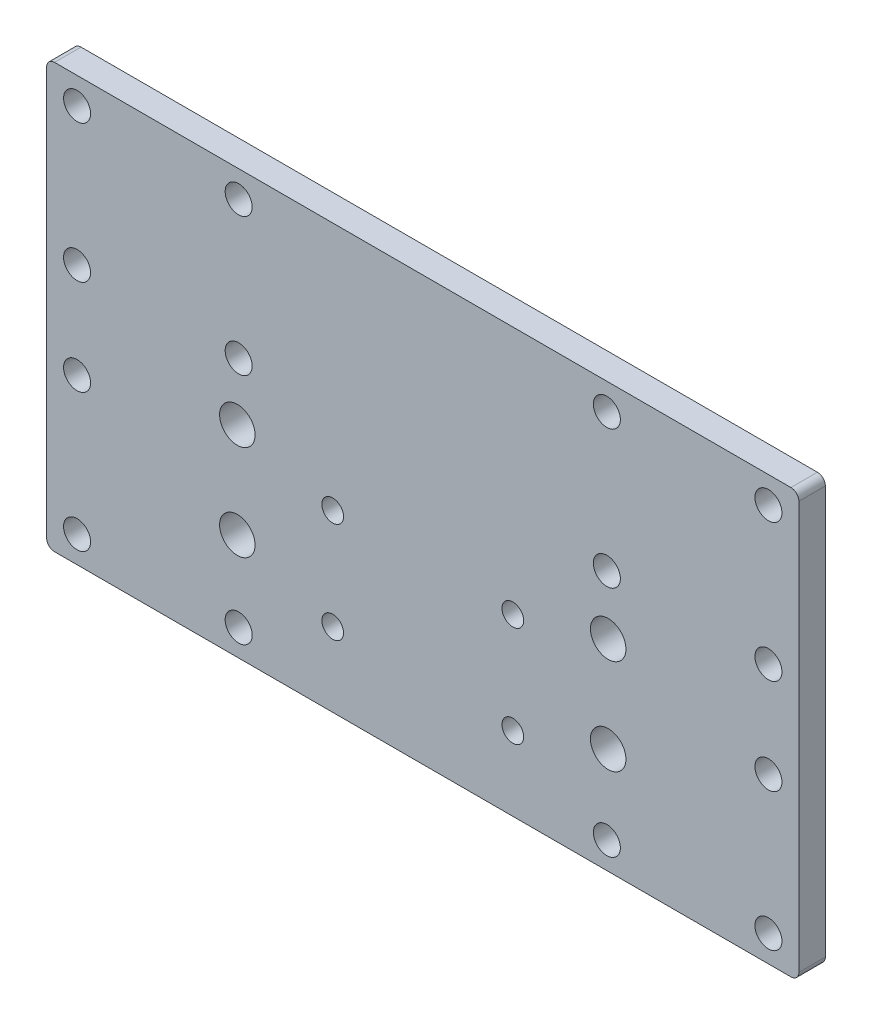
from build123d import *

# Parameters (mm, degrees)
SKETCH1_W           = 142
SKETCH1_H           = 80
BOSS_EXTRUDE1_DEPTH = 2.5
SKETCH2_R           = 2.55
CUT_EXTRUDE1_DEPTH  = 82.645575508
SKETCH3_R           = 2.05
CUT_EXTRUDE2_DEPTH  = 82.645575508
SKETCH4_R           = 3.35
CUT_EXTRUDE3_DEPTH  = 82.645575508
FILLET1_R           = 1.5


with BuildPart() as part:
    # Sketch1 → Boss-Extrude1 (new, symmetric)
    with BuildSketch(Plane.XY):
        Rectangle(SKETCH1_W, SKETCH1_H)
    extrude(amount=BOSS_EXTRUDE1_DEPTH, both=True)

    # Sketch2 → Cut-Extrude1 (cut, through all)
    with BuildSketch(Plane.XY.offset(2.5)):
        with Locations((-65.25, 35)):
            Circle(SKETCH2_R)
        with Locations((-34.75, 35)):
            Circle(SKETCH2_R)
        with Locations((-34.75, 9)):
            Circle(SKETCH2_R)
        with Locations((-65.25, 9)):
            Circle(SKETCH2_R)
        with Locations((65.25, 35)):
            Circle(SKETCH2_R)
        with Locations((65.25, 9)):
            Circle(SKETCH2_R)
        with Locations((34.75, 9)):
            Circle(SKETCH2_R)
        with Locations((34.75, 35)):
            Circle(SKETCH2_R)
        with Locations((-65.25, -9)):
            Circle(SKETCH2_R)
        with Locations((-34.75, -35)):
            Circle(SKETCH2_R)
        with Locations((-65.25, -35)):
            Circle(SKETCH2_R)
        with Locations((65.25, -9)):
            Circle(SKETCH2_R)
        with Locations((65.25, -35)):
            Circle(SKETCH2_R)
        with Locations((34.75, -35)):
            Circle(SKETCH2_R)
    extrude(amount=-CUT_EXTRUDE1_DEPTH, mode=Mode.SUBTRACT)

    # Sketch3 → Cut-Extrude2 (cut, through all)
    with BuildSketch(Plane.XY.offset(2.5)):
        with Locations((-17, -7)):
            Circle(SKETCH3_R)
        with Locations((-17, -26)):
            Circle(SKETCH3_R)
        with Locations((17, -26)):
            Circle(SKETCH3_R)
        with Locations((17, -7)):
            Circle(SKETCH3_R)
    extrude(amount=-CUT_EXTRUDE2_DEPTH, mode=Mode.SUBTRACT)

    # Sketch4 → Cut-Extrude3 (cut, through all)
    with BuildSketch(Plane.XY.offset(2.5)):
        with Locations((-35, -2)):
            Circle(SKETCH4_R)
        with Locations((35, -2)):
            Circle(SKETCH4_R)
        with Locations((35, -20)):
            Circle(SKETCH4_R)
        with Locations((-35, -20)):
            Circle(SKETCH4_R)
    extrude(amount=-CUT_EXTRUDE3_DEPTH, mode=Mode.SUBTRACT)

    # Fillet1
    fillet1_edges = [part.edges().sort_by_distance(p)[0] for p in [
        (-71, -40, 0),
        (71, -40, 0),
        (71, 40, 0),
        (-71, 40, 0),
    ]]
    fillet(fillet1_edges, radius=FILLET1_R)


solid = part.part
